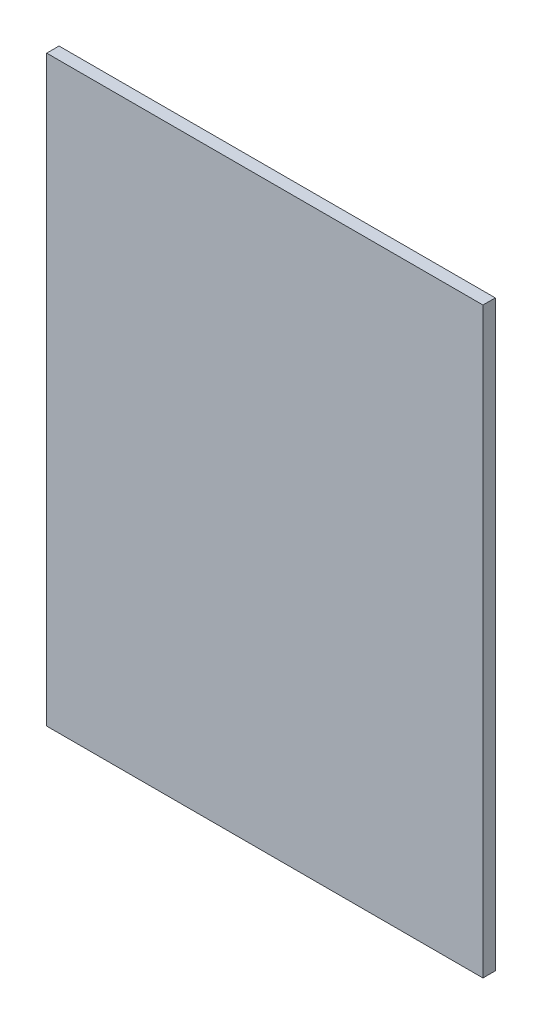
from build123d import *

# Parameters (mm, degrees)
SKETCH1_W           = 224.546707254
SKETCH1_H           = 300
BOSS_EXTRUDE1_DEPTH = 6.35


with BuildPart() as part:
    # Sketch1 → Boss-Extrude1 (new body)
    with BuildSketch(Plane.XY):
        with Locations((21.739808764, -46.397805356)):
            Rectangle(SKETCH1_W, SKETCH1_H)
    extrude(amount=BOSS_EXTRUDE1_DEPTH)


solid = part.part
